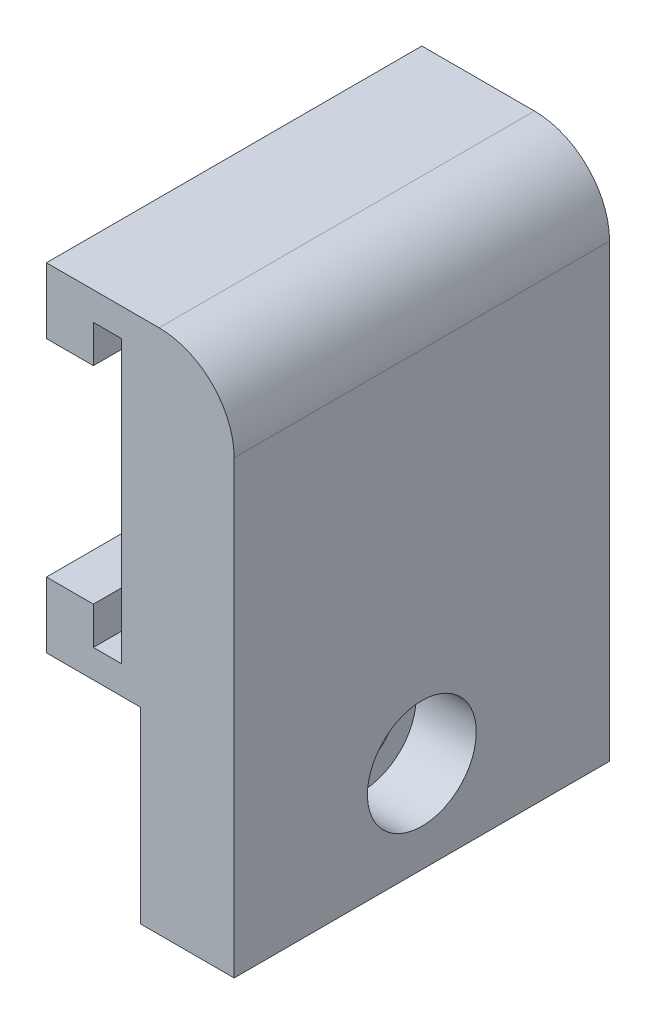
from build123d import *

# Parameters (mm, degrees)
BOSS_EXTRUDE1_DEPTH     = 12.7
CUT_EXTRUDE1_DEPTH      = 27.910817528
CUT_EXTRUDE1_DEPTH_BACK = 27.910817528
SCREWHOLE_R             = 2.159
CUT_EXTRUDE2_START      = -4.064
SKETCH3_R               = 3.683
SKETCH3_R_2             = 2.159
CUT_EXTRUDE2_DEPTH      = 4.064
CUT_EXTRUDE3_DEPTH      = 35.757187746
CUT_EXTRUDE3_DEPTH_BACK = 35.757187746
FILLET3_R               = 5.08


with BuildPart() as part:
    # Profile → Boss-Extrude1 (new, symmetric)
    with BuildSketch(Plane.XY):
        Polygon((6.35, 22.86), (-6.35, 22.86), (-6.35, 0), (0, 0), (0, -12.7), (6.35, -12.7), align=None)
    extrude(amount=BOSS_EXTRUDE1_DEPTH, both=True)

    # ScrewHole → Cut-Extrude1 (cut, two sides: drawn at the far end of the back side and taken through both)
    with BuildSketch(Plane.ZY.offset(-CUT_EXTRUDE1_DEPTH_BACK)):
        with Locations((0, -6.477)):
            Circle(SCREWHOLE_R)
    extrude(amount=CUT_EXTRUDE1_DEPTH + CUT_EXTRUDE1_DEPTH_BACK, mode=Mode.SUBTRACT)

    # Sketch3 → Cut-Extrude2 (cut)
    with BuildSketch(Plane(origin=(6.35, 0, 0), x_dir=(0, 0, -1), z_dir=(1, 0, 0)).offset(CUT_EXTRUDE2_START)):
        with Locations((0, -6.477)):
            Circle(SKETCH3_R)
        with Locations((0, -6.477)):
            Circle(SKETCH3_R_2, mode=Mode.SUBTRACT)
    extrude(amount=CUT_EXTRUDE2_DEPTH, mode=Mode.SUBTRACT)

    # Sketch6 → Cut-Extrude3 (cut, two sides: drawn at the far end of the back side and taken through both)
    with BuildSketch(Plane(origin=(0, 0, -12.7), x_dir=(-1, 0, 0), z_dir=(0, 0, -1)).offset(-CUT_EXTRUDE3_DEPTH_BACK)):
        Polygon((1.27, 20.955), (3.175, 20.955), (3.175, 18.415), (6.35, 18.415), (7.62, 18.415), (7.62, 4.445), (6.35, 4.445), (3.175, 4.445), (3.175, 1.905), (1.27, 1.905), align=None)
    extrude(amount=CUT_EXTRUDE3_DEPTH + CUT_EXTRUDE3_DEPTH_BACK, mode=Mode.SUBTRACT)

    # Fillet3
    fillet3_edges = [part.edges().sort_by_distance(p)[0] for p in [
        (6.35, 22.86, 0),
    ]]
    fillet(fillet3_edges, radius=FILLET3_R)


solid = part.part
